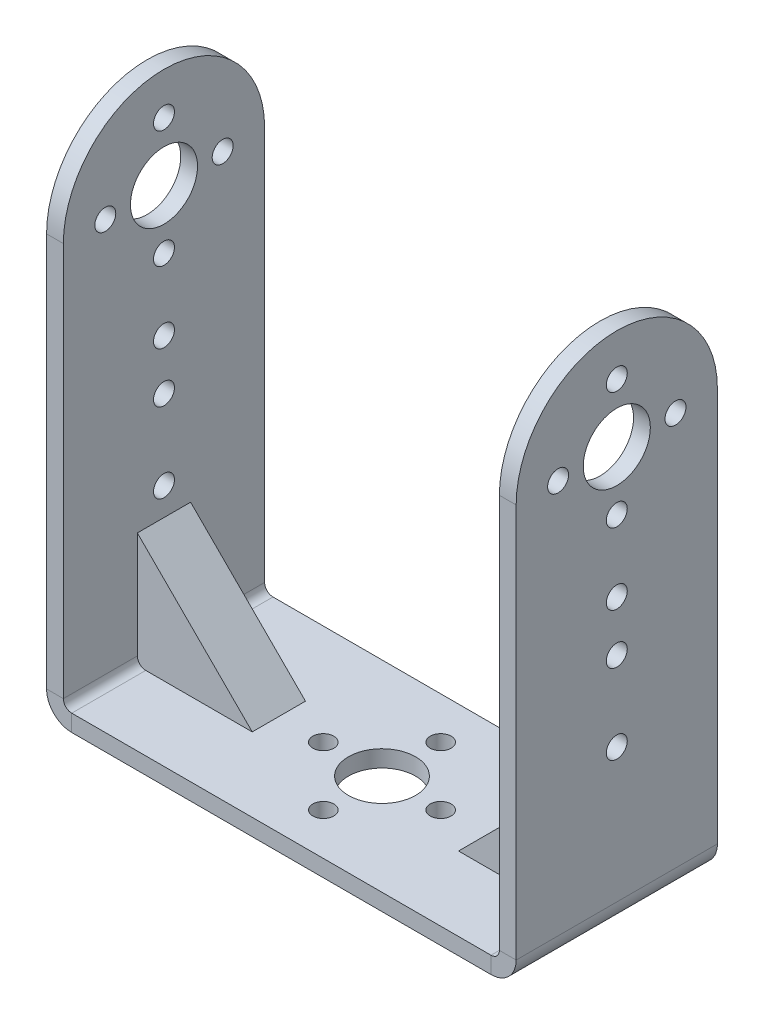
from build123d import *

# Parameters (mm, degrees)
T_LE_DE_BASE_PLI_E1_DEPTH       = 12
ENL_V_START                     = -56
ENL_V_MAT_EXTRU_1_DEPTH         = 56
DIAM_TRE_DU_PER_AGE_8_0_8_1_D   = 8
DIAM_TRE_DU_PER_AGE_2_5_2_5_1_D = 2.5
DIAM_TRE_DU_PER_AGE_8_0_8_2_D   = 8
DIAM_TRE_DU_PER_AGE_2_5_2_5_2_D = 2.5
BOSS_EXTRUDE1_DEPTH             = 3.175


# Read off the part's stored shape, not the designer's step: Enlèv. mat.-Extru.1
# Sheet-metal steps are written as plain solids
with BuildPart() as part:
    # Esquisse1 → Tôle de base pliée1 (new, symmetric)
    with BuildSketch(Plane.XY):
        with BuildLine():
            Line((-28, 62), (-28, 3))
            ThreePointArc((-28, 3), (-27.121320344, 0.878679656), (-25, 0))
            Line((-25, 0), (25, 0))
            ThreePointArc((25, 0), (27.121320344, 0.878679656), (28, 3))
            Line((28, 3), (28, 62))
            Line((28, 62), (26, 62))
            Line((26, 62), (26, 3))
            ThreePointArc((26, 3), (25.707106781, 2.292893219), (25, 2))
            Line((25, 2), (-25, 2))
            ThreePointArc((-25, 2), (-25.707106781, 2.292893219), (-26, 3))
            Line((-26, 3), (-26, 62))
            Line((-26, 62), (-28, 62))
        make_face()
    extrude(amount=T_LE_DE_BASE_PLI_E1_DEPTH, both=True)

    # Enlèv. mat.-Extru.1 outline → Enlèv. mat.-Extru.1 (cut)
    with BuildSketch(Plane(origin=(28, 0, 0), x_dir=(0, 0, -1), z_dir=(1, 0, 0)).offset(ENL_V_START)):
        with BuildLine():
            ThreePointArc((-12, 50), (-8.485281374, 58.485281374), (0, 62))
            Line((0, 62), (-12, 62))
            Line((-12, 62), (-12, 50))
        make_face()
        with BuildLine():
            ThreePointArc((0, 62), (8.485281374, 58.485281374), (12, 50))
            Line((12, 50), (12, 62))
            Line((12, 62), (0, 62))
        make_face()
    extrude(amount=ENL_V_MAT_EXTRU_1_DEPTH, mode=Mode.SUBTRACT)

    # Diamètre du perçage Ø8.0 (8)1 (through all)
    with Locations(Plane(origin=(28, 0, 0), x_dir=(0, 0, -1), z_dir=(1, 0, 0))):
        with Locations((0, 50)):
            Hole(DIAM_TRE_DU_PER_AGE_8_0_8_1_D / 2)

    # Diamètre du perçage Ø2.5 (2.5)1 (through all)
    with Locations(Plane(origin=(28, 0, 0), x_dir=(0, 0, -1), z_dir=(1, 0, 0))):
        with Locations((0, 57), (7, 50), (0, 43), (-7, 50), (0, 34.5), (0, 28.5), (0, 19)):
            Hole(DIAM_TRE_DU_PER_AGE_2_5_2_5_1_D / 2)

    # Diamètre du perçage Ø8.0 (8)2 (through all)
    with Locations(Plane(origin=(0, 2, 0), x_dir=(1, 0, 0), z_dir=(0, 1, 0))):
        with Locations((0, 0)):
            Hole(DIAM_TRE_DU_PER_AGE_8_0_8_2_D / 2)

    # Diamètre du perçage Ø2.5 (2.5)2 (through all)
    with Locations(Plane(origin=(0, 2, 0), x_dir=(1, 0, 0), z_dir=(0, 1, 0))):
        with Locations((0, 7), (7, 0), (0, -7), (-7, 0), (-15.5, 0), (15.5, 0)):
            Hole(DIAM_TRE_DU_PER_AGE_2_5_2_5_2_D / 2)

    # Sketch1 → Boss-Extrude1 (add, symmetric)
    with BuildSketch(Plane(origin=(0, 0, 0), x_dir=(-1, 0, 0), z_dir=(0, 0, -1))):
        with BuildLine():
            Line((26, 15.7), (12.3, 2))
            Line((12.3, 2), (25, 2))
            ThreePointArc((25, 2), (25.707106781, 2.292893219), (26, 3))
            Line((26, 3), (26, 15.7))
        make_face()
    boss_extrude1 = extrude(amount=BOSS_EXTRUDE1_DEPTH, both=True)

    # Mirror1: Boss-Extrude1 across plane
    add(boss_extrude1.mirror(Plane(origin=(0, 0, 0), x_dir=(0, 0, 1), z_dir=(1, 0, 0))))


solid = part.part
